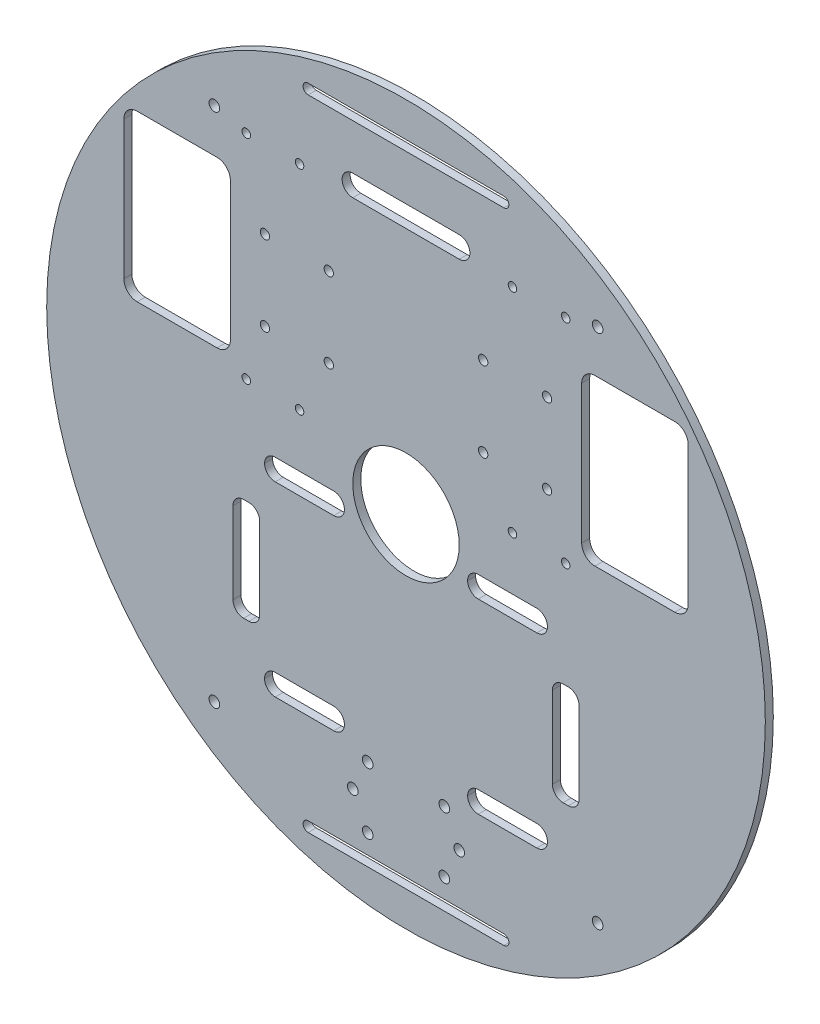
from build123d import *

# Parameters (mm, degrees)
SKETCH_1_R          = 135
SKETCH_1_R_2        = 2
SKETCH_1_W          = 40
SKETCH_1_H          = 62
SKETCH_1_R_3        = 1.75
EXTRUDE_1_DEPTH     = 3
FILLET_1_R          = 5
SKETCH_2_R          = 20
SKETCH_2_R_2        = 2
SKETCH_2_R_3        = 1.6
SKETCH_2_W          = 30
SKETCH_2_H          = 8
SKETCH_2_W_2        = 10
SKETCH_2_H_2        = 38.624758258
CUT_EXTRUDE_1_DEPTH = 10
FILLET_2_R          = 4


with BuildPart() as part:
    # 草图1 → 凸台-拉伸1 (new body)
    with BuildSketch(Plane.XY):
        Circle(SKETCH_1_R)
        with Locations((-14.4, -110.804246301)):
            Circle(SKETCH_1_R_2, mode=Mode.SUBTRACT)
        with Locations((-20, -99.304246301)):
            Circle(SKETCH_1_R_2, mode=Mode.SUBTRACT)
        with Locations((-14.4, -87.804246301)):
            Circle(SKETCH_1_R_2, mode=Mode.SUBTRACT)
        with Locations((14.4, -110.804246301)):
            Circle(SKETCH_1_R_2, mode=Mode.SUBTRACT)
        with Locations((14.4, -87.804246301)):
            Circle(SKETCH_1_R_2, mode=Mode.SUBTRACT)
        with Locations((20, -99.304246301)):
            Circle(SKETCH_1_R_2, mode=Mode.SUBTRACT)
        with Locations((-86, 49.65212315)):
            Rectangle(SKETCH_1_W, SKETCH_1_H, mode=Mode.SUBTRACT)
        with Locations((-53, 34.65212315)):
            Circle(SKETCH_1_R_3, mode=Mode.SUBTRACT)
        with Locations((-53, 64.65212315)):
            Circle(SKETCH_1_R_3, mode=Mode.SUBTRACT)
        with Locations((-29, 34.65212315)):
            Circle(SKETCH_1_R_3, mode=Mode.SUBTRACT)
        with Locations((-29, 64.65212315)):
            Circle(SKETCH_1_R_3, mode=Mode.SUBTRACT)
        with Locations((29, 34.65212315)):
            Circle(SKETCH_1_R_3, mode=Mode.SUBTRACT)
        with Locations((29, 64.65212315)):
            Circle(SKETCH_1_R_3, mode=Mode.SUBTRACT)
        with Locations((53, 34.65212315)):
            Circle(SKETCH_1_R_3, mode=Mode.SUBTRACT)
        with Locations((53, 64.65212315)):
            Circle(SKETCH_1_R_3, mode=Mode.SUBTRACT)
        with Locations((86, 49.65212315)):
            Rectangle(SKETCH_1_W, SKETCH_1_H, mode=Mode.SUBTRACT)
    extrude(amount=EXTRUDE_1_DEPTH)

    # 圆角1
    fillet_1_edges = [part.edges().sort_by_distance(p)[0] for p in [
        (66, 80.65212315, 1.5),
        (66, 18.65212315, 1.5),
        (106, 18.65212315, 1.5),
        (106, 80.65212315, 1.5),
        (-106, 80.65212315, 1.5),
        (-106, 18.65212315, 1.5),
        (-66, 18.65212315, 1.5),
        (-66, 80.65212315, 1.5),
    ]]
    fillet(fillet_1_edges, radius=FILLET_1_R)

    # 草图2 → 切除-拉伸1 (cut)
    with BuildSketch(Plane.XY.offset(3)):
        Circle(SKETCH_2_R)
        with Locations((-72, 97)):
            Circle(SKETCH_2_R_2)
        with Locations((72, 97)):
            Circle(SKETCH_2_R_2)
        with Locations((72, -97)):
            Circle(SKETCH_2_R_2)
        with Locations((-72, -97)):
            Circle(SKETCH_2_R_2)
        with Locations((-60, 94)):
            Circle(SKETCH_2_R_3)
        with Locations((-60, 14)):
            Circle(SKETCH_2_R_3)
        with Locations((-40, 94)):
            Circle(SKETCH_2_R_3)
        with Locations((-40, 14)):
            Circle(SKETCH_2_R_3)
        with Locations((60, 14)):
            Circle(SKETCH_2_R_3)
        with Locations((60, 94)):
            Circle(SKETCH_2_R_3)
        with Locations((40, 94)):
            Circle(SKETCH_2_R_3)
        with Locations((40, 14)):
            Circle(SKETCH_2_R_3)
        with Locations((38.142857143, -10)):
            Rectangle(SKETCH_2_W, SKETCH_2_H)
        with Locations((-38.142857143, -10)):
            Rectangle(SKETCH_2_W, SKETCH_2_H)
        with Locations((38.142857143, -80)):
            Rectangle(SKETCH_2_W, SKETCH_2_H)
        with Locations((-38.142857143, -80)):
            Rectangle(SKETCH_2_W, SKETCH_2_H)
        with Locations((60, -45)):
            Rectangle(SKETCH_2_W_2, SKETCH_2_H_2)
        with Locations((-60, -45)):
            Rectangle(SKETCH_2_W_2, SKETCH_2_H_2)
        with BuildLine():
            Line((-36.755588957, 121.9), (36.755588957, 121.9))
            ThreePointArc((36.755588957, 121.9), (38.655588957, 120), (36.755588957, 118.1))
            Line((36.755588957, 118.1), (-36.755588957, 118.1))
            ThreePointArc((-36.755588957, 118.1), (-38.655588957, 120), (-36.755588957, 121.9))
        make_face()
        with BuildLine():
            Line((-36.755588957, -118.1), (36.755588957, -118.1))
            ThreePointArc((36.755588957, -118.1), (38.655588957, -120), (36.755588957, -121.9))
            Line((36.755588957, -121.9), (-36.755588957, -121.9))
            ThreePointArc((-36.755588957, -121.9), (-38.655588957, -120), (-36.755588957, -118.1))
        make_face()
        with BuildLine():
            Line((20, 101), (-20, 101))
            ThreePointArc((-20, 101), (-24, 97), (-20, 93))
            Line((-20, 93), (20, 93))
            ThreePointArc((20, 93), (24, 97), (20, 101))
        make_face()
    extrude(amount=-CUT_EXTRUDE_1_DEPTH, mode=Mode.SUBTRACT)

    # 圆角2
    fillet_2_edges = [part.edges().sort_by_distance(p)[0] for p in [
        (-53.142857143, -84, 1.5),
        (-23.142857143, -84, 1.5),
        (-53.142857143, -76, 1.5),
        (-23.142857143, -76, 1.5),
        (23.142857143, -84, 1.5),
        (23.142857143, -76, 1.5),
        (53.142857143, -76, 1.5),
        (53.142857143, -84, 1.5),
        (-53.142857143, -14, 1.5),
        (-53.142857143, -6, 1.5),
        (-23.142857143, -14, 1.5),
        (-23.142857143, -6, 1.5),
        (23.142857143, -14, 1.5),
        (53.142857143, -14, 1.5),
        (23.142857143, -6, 1.5),
        (53.142857143, -6, 1.5),
        (-55, -64.312379129, 1.5),
        (-65, -64.312379129, 1.5),
        (55, -64.312379129, 1.5),
        (65, -64.312379129, 1.5),
        (-65, -25.687620871, 1.5),
        (-55, -25.687620871, 1.5),
        (65, -25.687620871, 1.5),
        (55, -25.687620871, 1.5),
    ]]
    fillet(fillet_2_edges, radius=FILLET_2_R - 0.0001)  # a hair under: the kernel refuses the full size


solid = part.part
